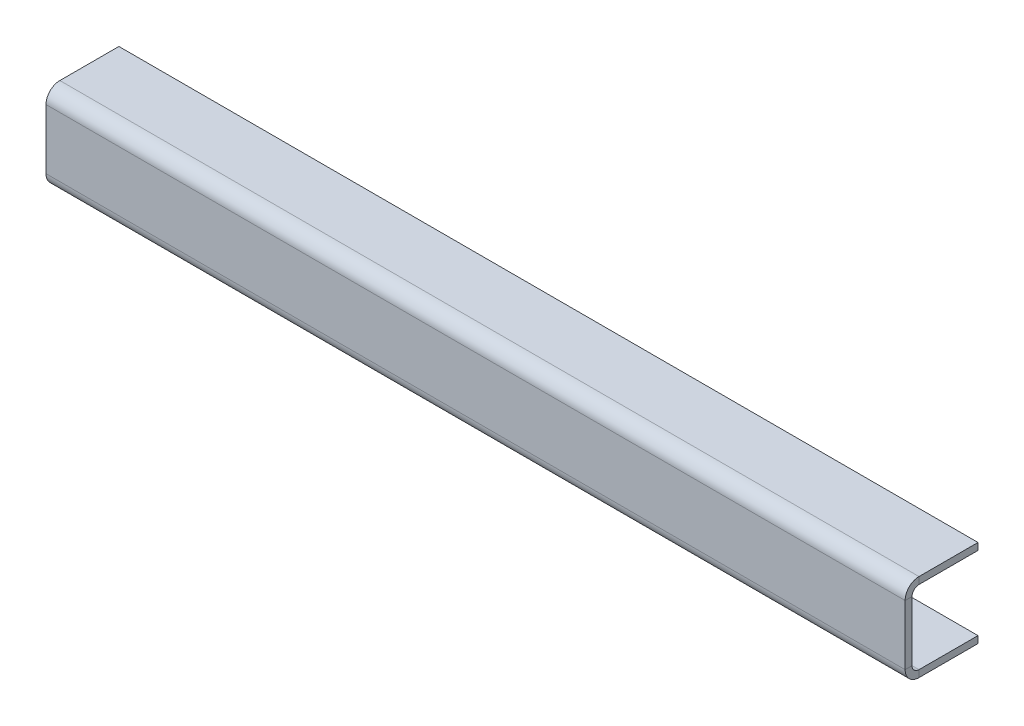
from build123d import *

# Parameters (mm, degrees)
BASE_FLANGE1_DEPTH = 393.7


# Sheet-metal steps are written as plain solids
with BuildPart() as part:
    # Sketch1 → Base-Flange1 (new body)
    with BuildSketch(Plane(origin=(0, 0, 0), x_dir=(0, 0, -1), z_dir=(1, 0, 0))):
        with BuildLine():
            Line((30.226, 33.782), (3.175, 33.782))
            ThreePointArc((3.175, 33.782), (0.92993597, 32.85206403), (0, 30.607))
            Line((0, 30.607), (0, 3.175))
            ThreePointArc((0, 3.175), (0.92993597, 0.92993597), (3.175, 0))
            Line((3.175, 0), (30.226, 0))
            Line((30.226, 0), (30.226, -3.175))
            Line((30.226, -3.175), (3.175, -3.175))
            ThreePointArc((3.175, -3.175), (-1.315128061, -1.315128061), (-3.175, 3.175))
            Line((-3.175, 3.175), (-3.175, 30.607))
            ThreePointArc((-3.175, 30.607), (-1.315128061, 35.097128061), (3.175, 36.957))
            Line((3.175, 36.957), (30.226, 36.957))
            Line((30.226, 36.957), (30.226, 33.782))
        make_face()
    extrude(amount=BASE_FLANGE1_DEPTH)


solid = part.part
